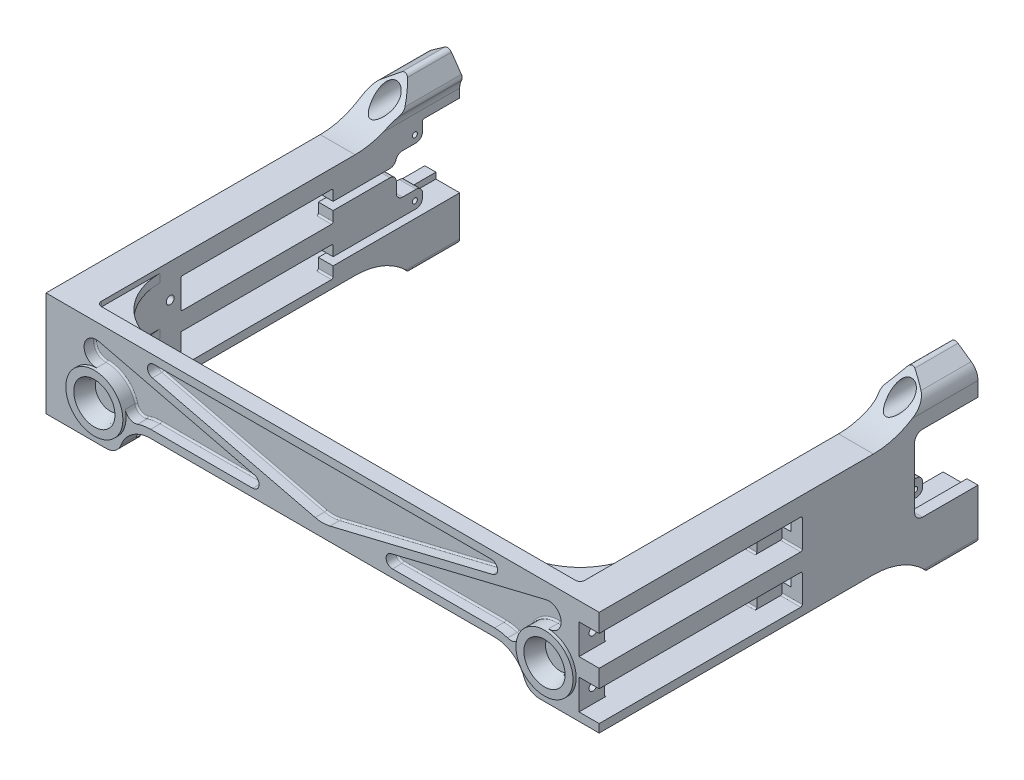
from build123d import *

# Parameters (mm, degrees)
BOSS_EXTRUDE1_DEPTH             = 10
SKETCH2_W                       = 109.5
SKETCH2_H                       = 33
BOSS_EXTRUDE2_DEPTH             = 11
SKETCH3_W                       = 5
SKETCH3_H                       = 33
BOSS_EXTRUDE3_DEPTH             = 76.25
FILLET1_R                       = 5
FILLET3_START                   = 10
FILLET3_OUTLINE_W               = 11
FILLET3_OUTLINE_H               = 8
FILLET3_DEPTH                   = 23
FILLET3_START_2                 = 75.125869623
FILLET3_2_DEPTH                 = 12.874130377
FILLET4_R                       = 1.5
CBORE_FOR_M3_SHCS1_D            = 3.2
CBORE_FOR_M3_SHCS1_CBORE_D      = 6.5
CBORE_FOR_M3_SHCS1_CBORE_DEPTH  = 112.5
SKETCH15_W                      = 20
SKETCH15_H                      = 24
CUT_EXTRUDE6_DEPTH              = 151.496054784
SKETCH16_W                      = 8.25
SKETCH16_H                      = 5.3868
SKETCH16_H_2                    = 0.5632
BOSS_EXTRUDE5_DEPTH             = 5.3
TAP_DRILL_FOR_M2X0_4_TAP1_D     = 1.6
TAP_DRILL_FOR_M2X0_4_TAP1_DEPTH = 11
TAP_DRILL_FOR_M2X0_4_TAP2_D     = 1.6
SKETCH8_W                       = 48
SKETCH8_H                       = 9.5
CUT_EXTRUDE1_DEPTH              = 205.374044434
SKETCH9_W                       = 48
SKETCH9_H                       = 9.5
CUT_EXTRUDE2_DEPTH              = 205.374044434
SKETCH11_W                      = 64
SKETCH11_H                      = 9.5
CUT_EXTRUDE3_DEPTH              = 6.35
SKETCH18_W                      = 64
SKETCH18_H                      = 9.5
CUT_EXTRUDE7_DEPTH              = 6.35
BOSS_EXTRUDE4_DEPTH             = 1.3
CUT_EXTRUDE4_START              = -63.4318
CUT_EXTRUDE4_OUTLINE_W          = 7.5
CUT_EXTRUDE4_OUTLINE_H          = 2.5
CUT_EXTRUDE4_DEPTH              = 63.4318
CUT_EXTRUDE5_REACH              = 152.496
SKETCH14_3_W                    = 7.5
SKETCH14_3_H                    = 2.5
FILLET5_R                       = 2.5
FILLET6_R                       = 1.5
FILLET7_R                       = 0.5
TAP_DRILL_FOR_M3X0_5_TAP3_D     = 2.5
FILLET8_R                       = 2
FILLET9_R                       = 2
FILLET10_R                      = 2
CUT_EXTRUDE8_DEPTH              = 151.496054921
FILLET11_R                      = 5
CUT_EXTRUDE9_START              = -6.35
CUT_EXTRUDE9_DEPTH              = 6.35
CUT_EXTRUDE10_DEPTH             = 3.5
BOSS_EXTRUDE6_START             = -3.5
BOSS_EXTRUDE6_DEPTH             = 3.5
SKETCH31_4_R                    = 9
BOSS_EXTRUDE7_DEPTH             = 1
SKETCH32_R                      = 6.5
CUT_EXTRUDE11_DEPTH             = 5
CUT_EXTRUDE11_DRAFT             = -20
CUT_EXTRUDE11_PROFILE_2_DEPTH   = 5
CUT_EXTRUDE11_PROFILE_2_DRAFT   = -20
TAP_DRILL_FOR_M3X0_5_TAP2_D     = 2.5
TAP_DRILL_FOR_M3X0_5_TAP2_DEPTH = 8
TAP_DRILL_FOR_M3X0_5_TAP2_TIP   = 0.751075774
FILLET12_R                      = 2
FILLET13_R                      = 0.5


with BuildPart() as part:
    # Sketch1 → Boss-Extrude1 (new body)
    with BuildSketch(Plane.XY):
        Polygon((75.125869723, 18.40506383), (76.25, 17.617939336), (76.25, -27.5), (87.25, -27.5), (87.25, 19.681853126), (79.714481214, 24.958280184), align=None)
    extrude(amount=BOSS_EXTRUDE1_DEPTH)

    # Sketch2 → Boss-Extrude2 (add)
    with BuildSketch(Plane.ZY.offset(-76.25)):
        with Locations((64.75, -3)):
            Rectangle(SKETCH2_W, SKETCH2_H)
    extrude(amount=-BOSS_EXTRUDE2_DEPTH)

    # Sketch3 → Boss-Extrude3 (add)
    with BuildSketch(Plane.ZY.offset(-76.25)):
        with Locations((117, -3)):
            Rectangle(SKETCH3_W, SKETCH3_H)
    extrude(amount=BOSS_EXTRUDE3_DEPTH)

    # Fillet1
    # the kernel refuses this fillet: 5 mm, written as the material it adds along each edge
    with BuildSketch(Plane(origin=(76.25, 17.617939336, 0), x_dir=(-0.8191520442890894, 0.5735764363509067, 0), z_dir=(0, 0, 1))) as fillet1_piece_1:
        with BuildLine():
            CenterArc((2.735457859, 4.810595289), FILLET1_R, 215, 39.179194345)
            Line((-1.360302362, 1.942713107), (0, 0))
            Line((0, 0), (1.372309676, 0))
        make_face()
    extrude(amount=10)
    # the kernel refuses this fillet: 5 mm, written as the material it takes off along each edge
    with BuildSketch(Plane(origin=(87.25, 19.681853126, -6.507088132), x_dir=(-0.8191520442889935, 0.5735764363510436, 0), z_dir=(0, 0, 1))) as fillet1_2_piece_1:
        with BuildLine():
            CenterArc((FILLET1_R * 0.520567050552, FILLET1_R), FILLET1_R, 215, 55)
            Line((-FILLET1_R * 0.298584993737, FILLET1_R * 0.426423563649), (0, 0))
            Line((0, 0), (FILLET1_R * 0.520567050552, 0))
        make_face()
    extrude(amount=23.014176264, mode=Mode.SUBTRACT)

    # Fillet3: read off the stored shape, not the designer's step
    # Fillet3 outline → Fillet3 (add)
    with BuildSketch(Plane.XY.offset(FILLET3_START)):
        with Locations((81.75, -23.5)):
            Rectangle(FILLET3_OUTLINE_W, FILLET3_OUTLINE_H)
        with BuildLine():
            Line((76.25, 15.246324542), (76.25, 13.5))
            Line((76.25, 13.5), (87.25, 13.5))
            Line((87.25, 13.5), (87.25, 17.079017873))
            ThreePointArc((87.25, 17.079017873), (86.685054166, 19.387760939), (85.117882182, 21.174778094))
            Line((85.117882182, 21.174778094), (79.714481214, 24.958280184))
            Line((79.714481214, 24.958280184), (75.125869723, 18.40506383))
            ThreePointArc((75.125869723, 18.40506383), (75.960591715, 16.922727146), (76.25, 15.246324542))
        make_face()
    extrude(amount=FILLET3_DEPTH)

    # Fillet3 2 outline → Fillet3 2 (cut)
    with BuildSketch(Plane.YZ.offset(FILLET3_START_2)):
        with BuildLine():
            ThreePointArc((-27.5, 15.564404226), (-21.59545504, 23.408336954), (-19.5, 33))
            Line((-19.5, 33), (-27.5, 33))
            Line((-27.5, 33), (-27.5, 15.564404226))
        make_face()
        with BuildLine():
            Line((24.958280184, 13.105560986), (26, 12.501209276))
            Line((26, 12.501209276), (26, 33))
            Line((26, 33), (13.5, 33))
            ThreePointArc((13.5, 33), (16.569375878, 21.520878861), (24.958280184, 13.105560986))
        make_face()
    extrude(amount=FILLET3_2_DEPTH, mode=Mode.SUBTRACT)

    # Fillet4
    fillet4_edges = [part.edges().sort_by_distance(p)[0] for p in [
        (76.25, -27.5, 7.782202113),
        (87.25, -27.5, 7.782202113),
        (79.714481214, 24.958280184, 5),
        (75.125869723, 18.40506383, 5),
    ]]
    fillet(fillet4_edges, radius=FILLET4_R)

    # CBORE for M3 SHCS1 (through all)
    with Locations(Plane.XY.offset(119.5)):
        with Locations((81.25, 19), (81.75, -23)):
            CounterBoreHole(CBORE_FOR_M3_SHCS1_D / 2, CBORE_FOR_M3_SHCS1_CBORE_D / 2, CBORE_FOR_M3_SHCS1_CBORE_DEPTH)

    # Sketch15 → Cut-Extrude6 (cut, through all)
    with BuildSketch(Plane.ZY.offset(-87.25)):
        with Locations((10, 0.5)):
            Rectangle(SKETCH15_W, SKETCH15_H)
    extrude(amount=CUT_EXTRUDE6_DEPTH, mode=Mode.SUBTRACT)

    # Sketch16 → Boss-Extrude5 (add)
    with BuildSketch(Plane.ZY.offset(-76.25)):
        with Locations((15.875, -8.2434)):
            Rectangle(SKETCH16_W, SKETCH16_H)
        with Locations((15.875, -11.2184)):
            Rectangle(SKETCH16_W, SKETCH16_H_2)
        with Locations((15.875, 9.8066)):
            Rectangle(SKETCH16_W, SKETCH16_H)
    extrude(amount=-BOSS_EXTRUDE5_DEPTH)

    # Mirror1: part across plane


with BuildPart() as part_1:
    add(part.part)
    add(part.part.mirror(Plane(origin=(0, 0, 0), x_dir=(0, 0, 1), z_dir=(1, 0, 0))))

    # Tap Drill for M2x0.4 Tap1
    with Locations(Plane.ZY.offset(-76.25)):
        with Locations((14.15, 9.525), (14.15, -8.525)):
            Hole(TAP_DRILL_FOR_M2X0_4_TAP1_D / 2, depth=TAP_DRILL_FOR_M2X0_4_TAP1_DEPTH)

    # Tap Drill for M2x0.4 Tap2 (through all)
    with Locations(Plane.ZY.offset(81.55)):
        with Locations((14.15, 9.525), (14.15, -8.525)):
            Hole(TAP_DRILL_FOR_M2X0_4_TAP2_D / 2)

    # Sketch8 → Cut-Extrude1 (cut, through all)
    with BuildSketch(Plane.ZY.offset(-76.25)):
        with Locations((87.4318, 2.9691)):
            Rectangle(SKETCH8_W, SKETCH8_H)
        with Locations((87.4318, -12.1439)):
            Rectangle(SKETCH8_W, SKETCH8_H)
    extrude(amount=-CUT_EXTRUDE1_DEPTH, mode=Mode.SUBTRACT)

    # Sketch9 → Cut-Extrude2 (cut, through all)
    with BuildSketch(Plane(origin=(-76.25, 0, 0), x_dir=(0, 0, -1), z_dir=(1, 0, 0))):
        with Locations((-63.9368, 2.9691)):
            Rectangle(SKETCH9_W, SKETCH9_H)
        with Locations((-63.9368, -12.1439)):
            Rectangle(SKETCH9_W, SKETCH9_H)
    extrude(amount=-CUT_EXTRUDE2_DEPTH, mode=Mode.SUBTRACT)

    # Sketch11 → Cut-Extrude3 (cut)
    with BuildSketch(Plane(origin=(87.25, 0, 0), x_dir=(0, 0, -1), z_dir=(1, 0, 0))):
        with Locations((-87.4318, 2.9691)):
            Rectangle(SKETCH11_W, SKETCH11_H)
        with Locations((-87.4318, -12.1439)):
            Rectangle(SKETCH11_W, SKETCH11_H)
    extrude(amount=-CUT_EXTRUDE3_DEPTH, mode=Mode.SUBTRACT)

    # Sketch18 → Cut-Extrude7 (cut)
    with BuildSketch(Plane.ZY.offset(87.25)):
        with Locations((63.9368, 2.9691)):
            Rectangle(SKETCH18_W, SKETCH18_H)
        with Locations((63.9368, -12.1439)):
            Rectangle(SKETCH18_W, SKETCH18_H)
    extrude(amount=-CUT_EXTRUDE7_DEPTH, mode=Mode.SUBTRACT)

    # Sketch13 → Boss-Extrude4 (add, symmetric)
    with BuildSketch(Plane(origin=(0, -18.19695, 0), x_dir=(1, 0, 0), z_dir=(0, 1, 0))):
        with BuildLine():
            Line((76.25, -114.5), (76.25, -94.5))
            ThreePointArc((76.25, -94.5), (70.392135624, -108.642135624), (56.25, -114.5))
            Line((56.25, -114.5), (76.25, -114.5))
        make_face()
        with BuildLine():
            Line((-76.25, -114.5), (-76.25, -94.5))
            ThreePointArc((-76.25, -94.5), (-70.392135624, -108.642135624), (-56.25, -114.5))
            Line((-56.25, -114.5), (-76.25, -114.5))
        make_face()
    boss_extrude4 = extrude(amount=BOSS_EXTRUDE4_DEPTH, both=True)

    # Sketch-Pattern8: Boss-Extrude4 at 2 more places
    with Locations((0, 28.8065, 0), (0, 13.60955, 0)):
        add(boss_extrude4)

    # Cut-Extrude4: read off the stored shape, not the designer's step
    # Cut-Extrude4 outline → Cut-Extrude4 (cut)
    with BuildSketch(Plane(origin=(0, 0, 0), x_dir=(-1, 0, 0), z_dir=(0, 0, -1)).offset(CUT_EXTRUDE4_START)):
        with Locations((-80, 2.9691)):
            Rectangle(CUT_EXTRUDE4_OUTLINE_W, CUT_EXTRUDE4_OUTLINE_H)
        with Locations((-80, -12.1439)):
            Rectangle(CUT_EXTRUDE4_OUTLINE_W, CUT_EXTRUDE4_OUTLINE_H)
    extrude(amount=CUT_EXTRUDE4_DEPTH, mode=Mode.SUBTRACT)

    # Cut-Extrude5: up to this face of the body (flat: up to its plane)
    cut_extrude5_end = Plane(part_1.part.faces().sort_by_distance((-78.575, 2.9691, 87.9368))[0])
    # Sketch14<3> → Cut-Extrude5 (cut, up to the picked face)
    with BuildSketch(Plane(origin=(0, 0, 0), x_dir=(-1, 0, 0), z_dir=(0, 0, -1)), mode=Mode.PRIVATE) as cut_extrude5_sk1:
        with Locations((80, 2.9691)):
            Rectangle(SKETCH14_3_W, SKETCH14_3_H)
    cut_extrude5_tool1 = split(extrude(cut_extrude5_sk1.sketch, amount=-CUT_EXTRUDE5_REACH, mode=Mode.PRIVATE), bisect_by=cut_extrude5_end, keep=Keep.BOTH, mode=Mode.PRIVATE)
    # Sketch14<3> → Cut-Extrude5 (cut, up to the picked face)
    with BuildSketch(Plane(origin=(0, 0, 0), x_dir=(-1, 0, 0), z_dir=(0, 0, -1)), mode=Mode.PRIVATE) as cut_extrude5_sk2:
        with Locations((80, -12.1439)):
            Rectangle(SKETCH14_3_W, SKETCH14_3_H)
    cut_extrude5_tool2 = split(extrude(cut_extrude5_sk2.sketch, amount=-CUT_EXTRUDE5_REACH, mode=Mode.PRIVATE), bisect_by=cut_extrude5_end, keep=Keep.BOTH, mode=Mode.PRIVATE)
    add(cut_extrude5_tool1.solids().sort_by(Axis((-80, 2.9691, 0), (0, 0, 1)))[0], mode=Mode.SUBTRACT)
    add(cut_extrude5_tool2.solids().sort_by(Axis((-80, -12.1439, 0), (0, 0, 1)))[0], mode=Mode.SUBTRACT)

    # Fillet5
    fillet5_edges = [part_1.edges().sort_by_distance(p)[0] for p in [
        (84.4, 12.5, 20),
        (85.5, -11.5, 20),
        (-84.4, 12.5, 20),
        (-85.5, -11.5, 20),
    ]]
    fillet(fillet5_edges, radius=FILLET5_R)

    # Fillet6
    fillet6_edges = [part_1.edges().sort_by_distance(p)[0] for p in [
        (-76.25, 12.704775, 114.5),
        (76.25, 12.704775, 114.5),
        (76.25, 3.011075, 114.5),
        (-76.25, 3.011075, 114.5),
        (76.25, -11.392175, 114.5),
        (-76.25, -11.392175, 114.5),
    ]]
    fillet(fillet6_edges, radius=FILLET6_R)

    # Fillet7
    fillet7_edges = [part_1.edges().sort_by_distance(p)[0] for p in [
        (78.9, 12.5, 11.75),
        (-78.9, 12.5, 11.75),
        (78.575, -1.7809, 111.4318),
        (78.575, -1.7809, 63.4318),
        (78.575, 7.7191, 111.4318),
        (78.575, 7.7191, 63.4318),
        (84.075, -1.7809, 55.4318),
        (84.075, 7.7191, 119.4318),
        (84.075, 7.7191, 55.4318),
        (84.075, -1.7809, 119.4318),
        (78.575, -16.8939, 111.4318),
        (78.575, -16.8939, 63.4318),
        (78.575, -7.3939, 111.4318),
        (78.575, -7.3939, 63.4318),
        (84.075, -7.3939, 119.4318),
        (84.075, -16.8939, 55.4318),
        (84.075, -16.8939, 119.4318),
        (84.075, -7.3939, 55.4318),
        (-78.575, -1.7809, 39.9368),
        (-78.575, -1.7809, 87.9368),
        (-78.575, 7.7191, 39.9368),
        (-78.575, 7.7191, 87.9368),
        (-84.075, 7.7191, 31.9368),
        (-84.075, -1.7809, 95.9368),
        (-84.075, 7.7191, 95.9368),
        (-78.575, -16.8939, 39.9368),
        (-78.575, -7.3939, 39.9368),
        (-84.075, -16.8939, 95.9368),
        (-84.075, -16.8939, 31.9368),
        (-84.075, -7.3939, 95.9368),
    ]]
    fillet(fillet7_edges, radius=FILLET7_R)

    # Tap Drill for M3x0.5 Tap3 (through all)
    with Locations(Plane.ZY.offset(80.9)):
        with Locations((91.318, 2.9691), (91.318, -12.1439)):
            Hole(TAP_DRILL_FOR_M3X0_5_TAP3_D / 2)

    # Fillet8
    fillet8_edges = [part_1.edges().sort_by_distance(p)[0] for p in [
        (78.9, -5.55, 11.75),
        (78.9, 7.1132, 11.75),
        (-78.9, -5.55, 11.75),
        (-78.9, 7.1132, 11.75),
    ]]
    fillet(fillet8_edges, radius=FILLET8_R)

    # Fillet9
    fillet9_edges = [part_1.edges().sort_by_distance(p)[0] for p in [
        (80, 1.7191, 20),
        (80, 4.2191, 20),
        (78.9, -10.8939, 11.75),
        (-80, 1.7191, 20),
        (-80, 4.2191, 20),
        (-78.9, -10.8939, 11.75),
    ]]
    fillet(fillet9_edges, radius=FILLET9_R)

    # Fillet10
    # the kernel refuses this fillet: 2 mm, written as the material it adds along each edge
    with BuildSketch(Plane(origin=(76.25, -5.55, 20), x_dir=(0, 1, 0), z_dir=(1, 0, 0)), Plane(origin=(-76.25, -5.55, 20), x_dir=(0, 0, -1), z_dir=(-1, 0, 0))) as fillet10_piece_1:
        with BuildLine():
            CenterArc((FILLET10_R, -FILLET10_R), FILLET10_R, 90, 90)
            Line((0, -FILLET10_R), (0, 0))
            Line((0, 0), (FILLET10_R, 0))
        make_face()
    extrude(amount=5.3)
    with BuildSketch(Plane(origin=(76.25, 7.1132, 20), x_dir=(0, 0, -1), z_dir=(1, 0, 0))) as fillet10_piece_2:
        with BuildLine():
            CenterArc((1.844084441, -2), FILLET10_R, 90, 73.950066168)
            Line((-0.077957779, -1.44705), (-0.270162002, -1.391755))
            ThreePointArc((-0.270162002, -1.391755), (-0.2, -0.8941), (-0.2, 0))
            Line((-0.2, 0), (0, 0.2))
            Line((0, 0.2), (1.844084441, 0.2))
            Line((1.844084441, 0.2), (1.844084441, 0))
        make_face()
    extrude(amount=5.3)
    with BuildSketch(Plane(origin=(-76.25, 7.1132, 20), x_dir=(0, 0, -1), z_dir=(-1, 0, 0))) as fillet10_piece_3:
        with BuildLine():
            CenterArc((1.844084441, 2), FILLET10_R, 196.049933832, 73.950066168)
            Line((-0.077957779, 1.44705), (-0.270162002, 1.391755))
            ThreePointArc((-0.270162002, 1.391755), (-0.2, 0.8941), (-0.2, 0))
            Line((-0.2, 0), (0, -0.2))
            Line((0, -0.2), (1.844084441, -0.2))
            Line((1.844084441, -0.2), (1.844084441, 0))
        make_face()
    extrude(amount=5.3)

    # Sketch28 → Cut-Extrude8 (cut, through all)
    with BuildSketch(Plane.XY.offset(119.5)):
        with BuildLine():
            Line((54.25, -9.75), (-54.25, -9.75))
            ThreePointArc((-54.25, -9.75), (-61.232120022, -12.591089468), (-64.246874512, -19.5))
            Line((-64.246874512, -19.5), (-44.253125488, -19.5))
            Line((-44.253125488, -19.5), (44.253125488, -19.5))
            Line((44.253125488, -19.5), (64.246874512, -19.5))
            ThreePointArc((64.246874512, -19.5), (61.232120022, -12.591089468), (54.25, -9.75))
        make_face()
    extrude(amount=-CUT_EXTRUDE8_DEPTH, mode=Mode.SUBTRACT)

    # Fillet11
    fillet11_edges = [part_1.edges().sort_by_distance(p)[0] for p in [
        (64.246874512, -19.5, 117),
        (-64.246874512, -19.5, 117),
    ]]
    fillet(fillet11_edges, radius=FILLET11_R)

    # Sketch29 → Cut-Extrude9 (cut)
    with BuildSketch(Plane(origin=(87.25, 0, 0), x_dir=(0, 0, -1), z_dir=(1, 0, 0)).offset(CUT_EXTRUDE9_START)):
        with BuildLine():
            ThreePointArc((-119.4318, 7.2191), (-119.285353391, 7.572653391), (-118.9318, 7.7191))
            Line((-118.9318, 7.7191), (-119.5, 7.7191))
            Line((-119.5, 7.7191), (-119.5, -1.7809))
            Line((-119.5, -1.7809), (-118.9318, -1.7809))
            ThreePointArc((-118.9318, -1.7809), (-119.285353391, -1.634453391), (-119.4318, -1.2809))
            Line((-119.4318, -1.2809), (-119.4318, 7.2191))
        make_face()
        with BuildLine():
            Line((-118.9318, -7.3939), (-119.5, -7.3939))
            Line((-119.5, -7.3939), (-119.5, -16.8939))
            Line((-119.5, -16.8939), (-118.9318, -16.8939))
            ThreePointArc((-118.9318, -16.8939), (-119.285353391, -16.747453391), (-119.4318, -16.3939))
            Line((-119.4318, -16.3939), (-119.4318, -7.8939))
            ThreePointArc((-119.4318, -7.8939), (-119.285353391, -7.540346609), (-118.9318, -7.3939))
        make_face()
    extrude(amount=CUT_EXTRUDE9_DEPTH, mode=Mode.SUBTRACT)

    # Sketch30 → Cut-Extrude10 (cut)
    with BuildSketch(Plane.XY.offset(119.5)):
        with BuildLine():
            Line((69.946477995, 11), (-69.946477995, 11))
            Line((-69.946477995, 11), (-2.356924321, -5.392150891))
            ThreePointArc((-2.356924321, -5.392150891), (0, -5.673873896), (2.356924321, -5.392150891))
            Line((2.356924321, -5.392150891), (69.946477995, 11))
        make_face()
        with BuildLine():
            Line((-75.25, 9.713763766), (-75.25, -17))
            Line((-75.25, -17), (-68.301245496, -17))
            ThreePointArc((-68.301245496, -17), (-66.876026215, -16.553959591), (-65.959371247, -15.375))
            ThreePointArc((-65.959371247, -15.375), (-61.376096407, -9.480202047), (-54.25, -7.25))
            Line((-54.25, -7.25), (-5.303522005, -7.25))
            Line((-5.303522005, -7.25), (-75.25, 9.713763766))
        make_face()
        with BuildLine():
            Line((75.25, 9.713763766), (5.303522005, -7.25))
            Line((5.303522005, -7.25), (54.25, -7.25))
            ThreePointArc((54.25, -7.25), (61.376096407, -9.480202047), (65.959371247, -15.375))
            ThreePointArc((65.959371247, -15.375), (66.876026215, -16.553959591), (68.301245496, -17))
            Line((68.301245496, -17), (75.25, -17))
            Line((75.25, -17), (75.25, 9.713763766))
        make_face()
    extrude(amount=-CUT_EXTRUDE10_DEPTH, mode=Mode.SUBTRACT)

    # Boss-Extrude6: read off the stored shape, not the designer's step
    # Boss-Extrude6 outline → Boss-Extrude6 (add)
    with BuildSketch(Plane.XY.offset(119.5).offset(BOSS_EXTRUDE6_START)):
        with BuildLine():
            ThreePointArc((70.506175676, 8.563268166), (73.784215266, 7.849998097), (75.25, 4.832420781))
            Line((75.25, 4.832420781), (75.25, 9.713763766))
            Line((75.25, 9.713763766), (70.506175676, 8.563268166))
        make_face()
        with BuildLine():
            ThreePointArc((75.25, 4.832420781), (74.081779965, 2.074730187), (71.28810592, 0.995387428))
            ThreePointArc((71.28810592, 0.995387428), (65.568076148, -0.824053842), (62.264186702, -5.835383171))
            ThreePointArc((62.264186702, -5.835383171), (60.780602791, -7.751988512), (58.364716884, -7.946648571))
            ThreePointArc((58.364716884, -7.946648571), (62.990454367, -10.813867869), (65.959371247, -15.375))
            ThreePointArc((65.959371247, -15.375), (66.876026215, -16.553959591), (68.301245496, -17))
            Line((68.301245496, -17), (75.25, -17))
            Line((75.25, -17), (75.25, 4.832420781))
        make_face()
        with BuildLine():
            Line((-75.25, 9.713763766), (-75.25, 4.832420781))
            ThreePointArc((-75.25, 4.832420781), (-73.784215266, 7.849998097), (-70.506175676, 8.563268166))
            Line((-70.506175676, 8.563268166), (-75.25, 9.713763766))
        make_face()
        with BuildLine():
            ThreePointArc((-58.364716884, -7.946648571), (-60.780602791, -7.751988512), (-62.264186702, -5.835383171))
            ThreePointArc((-62.264186702, -5.835383171), (-65.568076148, -0.824053842), (-71.28810592, 0.995387428))
            ThreePointArc((-71.28810592, 0.995387428), (-74.081779965, 2.074730187), (-75.25, 4.832420781))
            Line((-75.25, 4.832420781), (-75.25, -17))
            Line((-75.25, -17), (-68.301245496, -17))
            ThreePointArc((-68.301245496, -17), (-66.876026215, -16.553959591), (-65.959371247, -15.375))
            ThreePointArc((-65.959371247, -15.375), (-62.990454367, -10.813867869), (-58.364716884, -7.946648571))
        make_face()
    extrude(amount=BOSS_EXTRUDE6_DEPTH)

    # Sketch31<4> → Boss-Extrude7 (add)
    with BuildSketch(Plane.XY.offset(119.5)):
        with Locations((-71, -8)):
            Circle(SKETCH31_4_R)
        with Locations(Location((71, -8, 0), (0, 0, 88.165547348))):
            Circle(SKETCH31_4_R)
    extrude(amount=BOSS_EXTRUDE7_DEPTH)


with BuildPart() as cut_extrude11_tool:
    # Sketch32 → Cut-Extrude11 (with draft: the straight prism first)
    with BuildSketch(Plane.XY.offset(120.5)):
        with Locations((-71, -8)):
            Circle(SKETCH32_R)
    extrude(amount=-CUT_EXTRUDE11_DEPTH)
    # Cut-Extrude11: the draft: its side faces are tilted about the plane it starts from
    cut_extrude11_sides = [cut_extrude11_tool.faces().sort_by_distance(p)[0] for p in [
        (-77.5, -8, 118),
    ]]
    draft(cut_extrude11_sides, Plane.XY.offset(120.5), CUT_EXTRUDE11_DRAFT)


with BuildPart() as part_2:
    add(part_1.part)

    # Cut-Extrude11: cut by cut_extrude11_tool
    add(cut_extrude11_tool.part, mode=Mode.SUBTRACT)


with BuildPart() as cut_extrude11_profile_2_tool:
    # Sketch32 → Cut-Extrude11 profile 2 (with draft: the straight prism first)
    with BuildSketch(Plane.XY.offset(120.5)):
        with Locations((71, -8)):
            Circle(SKETCH32_R)
    extrude(amount=-CUT_EXTRUDE11_PROFILE_2_DEPTH)
    # Cut-Extrude11 profile 2: the draft: its side faces are tilted about the plane it starts from
    cut_extrude11_profile_2_sides = [cut_extrude11_profile_2_tool.faces().sort_by_distance(p)[0] for p in [
        (64.5, -8, 118),
    ]]
    draft(cut_extrude11_profile_2_sides, Plane.XY.offset(120.5), CUT_EXTRUDE11_PROFILE_2_DRAFT)


with BuildPart() as part_3:
    add(part_2.part)

    # Cut-Extrude11 profile 2: cut by cut_extrude11_profile_2_tool
    add(cut_extrude11_profile_2_tool.part, mode=Mode.SUBTRACT)

    # Tap Drill for M3x0.5 Tap2
    with Locations(Plane(origin=(80.9, 0, 0), x_dir=(0, 0, -1), z_dir=(1, 0, 0))):
        with Locations((-115.0971, 2.9691), (-115.0971, -12.1439)):
            Hole(TAP_DRILL_FOR_M3X0_5_TAP2_D / 2, depth=TAP_DRILL_FOR_M3X0_5_TAP2_DEPTH)
            with Locations((0, 0, -(TAP_DRILL_FOR_M3X0_5_TAP2_DEPTH + TAP_DRILL_FOR_M3X0_5_TAP2_TIP / 2))):  # 118° drill point
                Cone(0, TAP_DRILL_FOR_M3X0_5_TAP2_D / 2, TAP_DRILL_FOR_M3X0_5_TAP2_TIP, mode=Mode.SUBTRACT)

    # Fillet12
    fillet12_edges = [part_3.edges().sort_by_distance(p)[0] for p in [
        (-69.946477995, 11, 117.75),
        (69.946477995, 11, 117.75),
        (-5.303522005, -7.25, 117.75),
        (5.303522005, -7.25, 117.75),
    ]]
    fillet(fillet12_edges, radius=FILLET12_R)

    # Fillet13
    # the kernel refuses this fillet: 0.5 mm, written as the material it adds along each edge
    with BuildSketch(Plane(origin=(70.506175676, 8.563268166, 116), x_dir=(0, 0, 1), z_dir=(-0.9718276994675079, -0.23569243209677143, 0)), Plane(origin=(-21.564347691, -3.306344601, 116), x_dir=(0, 0, 1), z_dir=(-0.9718276994675079, 0.23569243209677143, 0))) as fillet13_piece_1:
        with BuildLine():
            CenterArc((FILLET13_R, -FILLET13_R), FILLET13_R, 90, 90)
            Line((0, -FILLET13_R), (0, 0))
            Line((0, 0), (FILLET13_R, 0))
        make_face()
    extrude(amount=50.360602)
    with BuildSketch(Plane(origin=(22.035732555, -5.25, 116), x_dir=(0, -1, 0), z_dir=(1, 0, 0))) as fillet13_piece_2:
        with BuildLine():
            CenterArc((2 - FILLET13_R, -FILLET13_R), FILLET13_R, 0, 90)
            Line((2 - FILLET13_R, 0), (2, 0))
            Line((2, 0), (2, -FILLET13_R))
        make_face()
    revolve(axis=Axis((22.035732555, -5.25, 116), (0, 0, -1)), revolution_arc=166.36755722)
    with BuildSketch(Plane(origin=(22.035732555, -7.25, 116), x_dir=(0, 0, 1), z_dir=(1, 0, 0)), Plane(origin=(-54.25, -7.25, 116), x_dir=(0, 0, 1), z_dir=(1, 0, 0))) as fillet13_piece_3:
        with BuildLine():
            CenterArc((FILLET13_R, -FILLET13_R), FILLET13_R, 90, 90)
            Line((0, -FILLET13_R), (0, 0))
            Line((0, 0), (FILLET13_R, 0))
        make_face()
    extrude(amount=32.214267445)
    with BuildSketch(Plane(origin=(-54.25, -19.75, 116), x_dir=(-0.3291773507284794, 0.9442681143443209, 0), z_dir=(-0.9442681143443209, -0.3291773507284794, 0))) as fillet13_piece_4:
        with BuildLine():
            CenterArc((12.5 + FILLET13_R, -FILLET13_R), FILLET13_R, 90, 90)
            Line((12.5 + FILLET13_R, 0), (12.5, 0))
            Line((12.5, 0), (12.5, -FILLET13_R))
        make_face()
    revolve(axis=Axis((-54.25, -19.75, 116), (0, 0, -1)), revolution_arc=19.218851644)
    with BuildSketch(Plane(origin=(-22.035732555, -5.25, 116), x_dir=(0.23569243209677107, 0.971827699467508, 0), z_dir=(-0.971827699467508, 0.23569243209677107, 0))) as fillet13_piece_5:
        with BuildLine():
            CenterArc((2 - FILLET13_R, -FILLET13_R), FILLET13_R, 0, 90)
            Line((2 - FILLET13_R, 0), (2, 0))
            Line((2, 0), (2, -FILLET13_R))
        make_face()
    revolve(axis=Axis((-22.035732555, -5.25, 116), (0, 0, -1)), revolution_arc=166.36755722)
    with BuildSketch(Plane(origin=(0, 4.326126104, 116), x_dir=(-0.23569243209677077, -0.971827699467508, 0), z_dir=(-0.971827699467508, 0.23569243209677077, 0))) as fillet13_piece_6:
        with BuildLine():
            CenterArc((10 - FILLET13_R, FILLET13_R), FILLET13_R, 270, 90)
            Line((10 - FILLET13_R, 0), (10, 0))
            Line((10, 0), (10, FILLET13_R))
        make_face()
    revolve(axis=Axis((0, 4.326126104, 116), (0, 0, 1)), revolution_arc=27.264885561)
    with BuildSketch(Plane(origin=(-53.685652309, 7.056344601, 116), x_dir=(0, 0, 1), z_dir=(0.9718276994675079, -0.23569243209677143, 0)), Plane(origin=(2.356924321, -5.392150891, 116), x_dir=(0, 0, 1), z_dir=(0.9718276994675079, 0.23569243209677143, 0))) as fillet13_piece_7:
        with BuildLine():
            CenterArc((FILLET13_R, -FILLET13_R), FILLET13_R, 90, 90)
            Line((0, -FILLET13_R), (0, 0))
            Line((0, 0), (FILLET13_R, 0))
        make_face()
    extrude(amount=52.816695816)
    with BuildSketch(Plane(origin=(-53.214267445, 9, 116), x_dir=(-0.2356924320967727, -0.9718276994675077, 0), z_dir=(0.9718276994675077, -0.2356924320967727, 0))) as fillet13_piece_8:
        with BuildLine():
            CenterArc((2 - FILLET13_R, -FILLET13_R), FILLET13_R, 0, 90)
            Line((2 - FILLET13_R, 0), (2, 0))
            Line((2, 0), (2, -FILLET13_R))
        make_face()
    revolve(axis=Axis((-53.214267445, 9, 116), (0, 0, -1)), revolution_arc=166.36755722)
    with BuildSketch(Plane(origin=(53.214267445, 11, 116), x_dir=(0, 0, 1), z_dir=(-1, 0, 0))) as fillet13_piece_9:
        with BuildLine():
            CenterArc((FILLET13_R, -FILLET13_R), FILLET13_R, 90, 90)
            Line((0, -FILLET13_R), (0, 0))
            Line((0, 0), (FILLET13_R, 0))
        make_face()
    extrude(amount=106.42853489)
    with BuildSketch(Plane(origin=(53.214267445, 9, 116), x_dir=(0, 1, 0), z_dir=(-1, 0, 0))) as fillet13_piece_10:
        with BuildLine():
            CenterArc((2 - FILLET13_R, -FILLET13_R), FILLET13_R, 0, 90)
            Line((2 - FILLET13_R, 0), (2, 0))
            Line((2, 0), (2, -FILLET13_R))
        make_face()
    revolve(axis=Axis((53.214267445, 9, 116), (0, 0, -1)), revolution_arc=166.36755722)
    with BuildSketch(Plane(origin=(54.25, -19.75, 116), x_dir=(0, 1, 0), z_dir=(-1, 0, 0))) as fillet13_piece_11:
        with BuildLine():
            CenterArc((12.5 + FILLET13_R, -FILLET13_R), FILLET13_R, 90, 90)
            Line((12.5 + FILLET13_R, 0), (12.5, 0))
            Line((12.5, 0), (12.5, -FILLET13_R))
        make_face()
    revolve(axis=Axis((54.25, -19.75, 116), (0, 0, -1)), revolution_arc=19.218851644)
    with BuildSketch(Plane(origin=(71, -8, 116), x_dir=(0.03201176884451103, 0.9994874919954955, 0), z_dir=(0.9994874919954955, -0.03201176884451103, 0))) as fillet13_piece_12:
        with BuildLine():
            CenterArc((9 + FILLET13_R, FILLET13_R), FILLET13_R, 180, 90)
            Line((9, FILLET13_R), (9, 0))
            Line((9, 0), (9 + FILLET13_R, 0))
        make_face()
    revolve(axis=Axis((71, -8, 116), (0, 0, 1)), revolution_arc=77.917633767)
    with BuildSketch(Plane(origin=(71.410999127, 4.832420782, 116), x_dir=(0.8939887908183362, -0.4480893235630248, 0), z_dir=(0.4480893235630248, 0.8939887908183362, 0))) as fillet13_piece_13_section:
        with BuildLine():
            CenterArc((3.839000873 - FILLET13_R, -FILLET13_R), FILLET13_R, 0, 90)
            Line((3.839000873 - FILLET13_R, 0), (3.839000873, 0))
            Line((3.839000873, 0), (3.839000873, -FILLET13_R))
        make_face()
    fillet13_piece_13 = revolve(axis=Axis((71.410999127, 4.832420782, 116), (0, 0, -1)), revolution_arc=65.213289772, mode=Mode.PRIVATE)
    fillet13_piece_13 = fillet13_piece_13 - Plane(origin=(71.410999127, 2.9691, 115.0971), x_dir=(0, 0, 1), z_dir=(-1, 0, 0)) * Cylinder(1.25, 16, mode=Mode.PRIVATE)
    add(fillet13_piece_13)
    with BuildSketch(Plane(origin=(71.410999129, 4.832420782, 116), x_dir=(-0.23569243235679915, 0.9718276994044447, 0), z_dir=(-0.9718276994044447, -0.23569243235679915, 0))) as fillet13_piece_14:
        with BuildLine():
            CenterArc((3.839000871 - FILLET13_R, -FILLET13_R), FILLET13_R, 0, 90)
            Line((3.839000871 - FILLET13_R, 0), (3.839000871, 0))
            Line((3.839000871, 0), (3.839000871, -FILLET13_R))
        make_face()
    revolve(axis=Axis((71.410999129, 4.832420782, 116), (0, 0, -1)), revolution_arc=103.632442805)
    with BuildSketch(Plane(origin=(-71, -8, 116), x_dir=(0.9706459220388489, 0.24051298099968066, 0), z_dir=(0.24051298099968066, -0.9706459220388489, 0))) as fillet13_piece_15:
        with BuildLine():
            CenterArc((9 + FILLET13_R, FILLET13_R), FILLET13_R, 180, 90)
            Line((9, FILLET13_R), (9, 0))
            Line((9, 0), (9 + FILLET13_R, 0))
        make_face()
    revolve(axis=Axis((-71, -8, 116), (0, 0, 1)), revolution_arc=77.917633767)
    with BuildSketch(Plane(origin=(-71.410999129, 4.832420782, 116), x_dir=(-1.0, -1.582882115822978e-10, 0), z_dir=(1.582882115822978e-10, -1.0, 0))) as fillet13_piece_16:
        with BuildLine():
            CenterArc((3.839000871 - FILLET13_R, -FILLET13_R), FILLET13_R, 0, 90)
            Line((3.839000871 - FILLET13_R, 0), (3.839000871, 0))
            Line((3.839000871, 0), (3.839000871, -FILLET13_R))
        make_face()
    revolve(axis=Axis((-71.410999129, 4.832420782, 116), (0, 0, -1)), revolution_arc=103.632442805)
    with BuildSketch(Plane(origin=(59.352248936, -5.113844228, 116), x_dir=(0.9706459220043148, -0.24051298113905129, 0), z_dir=(0.24051298113905129, 0.9706459220043148, 0))) as fillet13_piece_17:
        with BuildLine():
            CenterArc((3 - FILLET13_R, -FILLET13_R), FILLET13_R, 0, 90)
            Line((3 - FILLET13_R, 0), (3, 0))
            Line((3, 0), (3, -FILLET13_R))
        make_face()
    revolve(axis=Axis((59.352248936, -5.113844228, 116), (0, 0, -1)), revolution_arc=95.302032741)
    with BuildSketch(Plane(origin=(-59.352248936, -5.113844228, 116), x_dir=(0.3291773505443636, -0.9442681144085048, 0), z_dir=(0.9442681144085048, 0.3291773505443636, 0))) as fillet13_piece_18:
        with BuildLine():
            CenterArc((3 - FILLET13_R, -FILLET13_R), FILLET13_R, 0, 90)
            Line((3 - FILLET13_R, 0), (3, 0))
            Line((3, 0), (3, -FILLET13_R))
        make_face()
    revolve(axis=Axis((-59.352248936, -5.113844228, 116), (0, 0, -1)), revolution_arc=95.302032741)
    with BuildSketch(Plane(origin=(-71.410999127, 4.832420782, 116), x_dir=(0.0320117685665257, -0.9994874920043988, 0), z_dir=(0.9994874920043988, 0.0320117685665257, 0))) as fillet13_piece_19:
        with BuildLine():
            CenterArc((3.839000873 - FILLET13_R, -FILLET13_R), FILLET13_R, 0, 90)
            Line((3.839000873 - FILLET13_R, 0), (3.839000873, 0))
            Line((3.839000873, 0), (3.839000873, -FILLET13_R))
        make_face()
    revolve(axis=Axis((-71.410999127, 4.832420782, 116), (0, 0, -1)), revolution_arc=91.834452621)
    with BuildSketch(Plane(origin=(71.410999127, 4.832420782, 116), x_dir=(1.0, -2.342314978813794e-10, 0), z_dir=(2.342314978813794e-10, 1.0, 0))) as fillet13_piece_20_section:
        with BuildLine():
            CenterArc((3.839000873 - FILLET13_R, -FILLET13_R), FILLET13_R, 0, 90)
            Line((3.839000873 - FILLET13_R, 0), (3.839000873, 0))
            Line((3.839000873, 0), (3.839000873, -FILLET13_R))
        make_face()
    fillet13_piece_20 = revolve(axis=Axis((71.410999127, 4.832420782, 116), (0, 0, -1)), revolution_arc=33.737408153, mode=Mode.PRIVATE)
    fillet13_piece_20 = fillet13_piece_20 - Plane(origin=(71.410999127, 2.9691, 115.0971), x_dir=(0, 0, 1), z_dir=(-1, 0, 0)) * Cylinder(1.25, 16, mode=Mode.PRIVATE)
    add(fillet13_piece_20)


solid = part_3.part
